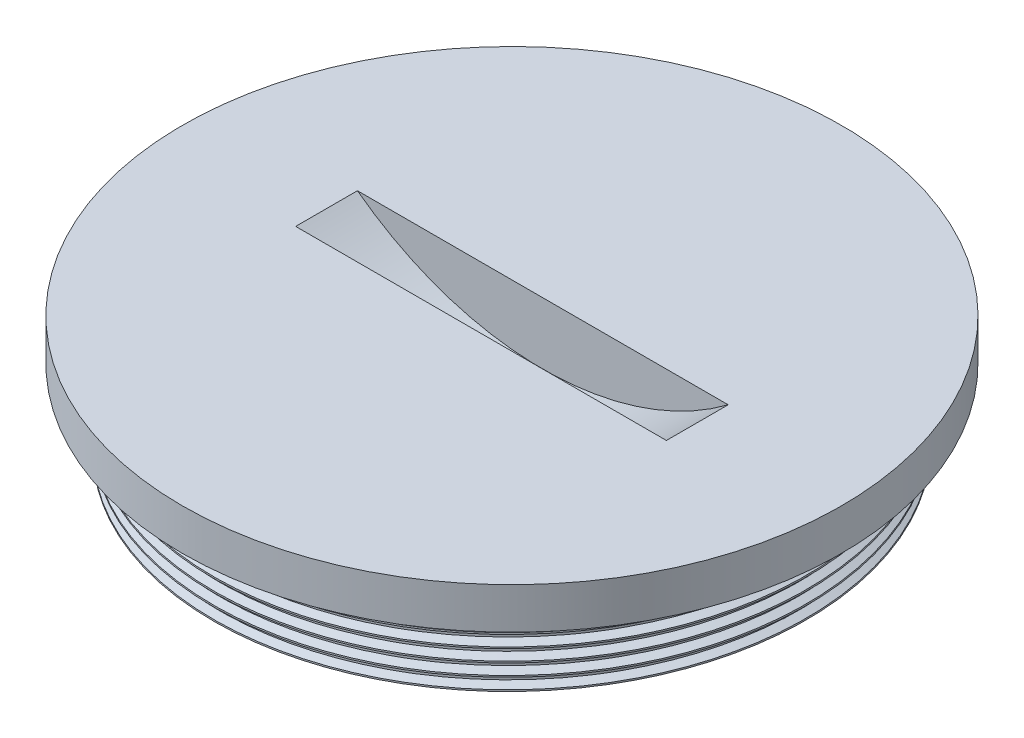
from build123d import *

# Parameters (mm, degrees)
SKETCH1_R                     = 14.05
BOSS_EXTRUDE1_DEPTH           = 12.7
MINCOLWIDTH_ONTRACKING1_PITCH = 0.6
CUT_EXTRUDE2_DEPTH            = 24.97001941
CUT_EXTRUDE2_DEPTH_BACK       = 24.97001941
SKETCH2_OUTSIDE_W             = 39.296
SKETCH2_OUTSIDE_H             = 23.696
SKETCH2_OUTSIDE_W_2           = 50
SKETCH2_OUTSIDE_H_2           = 3.81
SKETCH3_R                     = 16
BOSS_EXTRUDE2_DEPTH           = 2
CUT_EXTRUDE3_DEPTH            = 1.5
CUT_EXTRUDE3_DEPTH_BACK       = 1.5


with BuildPart() as part:
    # Sketch1 → Boss-Extrude1 (new body)
    with BuildSketch(Plane(origin=(0, 0, 0), x_dir=(1, 0, 0), z_dir=(0, 1, 0))):
        with Locations(Location((0, 0, 0), (0, 0, 270))):
            Circle(SKETCH1_R)
    extrude(amount=BOSS_EXTRUDE1_DEPTH)

    # MinColWidth_OnTracking1: the profile of HeaderRowsCount1 profile screwed along a right-hand helix of 21.166667 turns, 6 arcs to a turn; built about Z, then put on its axis
    mincolwidth_ontracking1_z = Axis((0, 0, 0), (0, 0, 1))
    mincolwidth_ontracking1_corners = [(14.0497, 0, -0.000173205), (14.374759525, 0, 0.187499999), (14.374759525, 0, 0.262499999), (14.0497, 0, 0.450173203)]
    with BuildLine(mode=Mode.PRIVATE) as mincolwidth_ontracking1_profile:
        Line(mincolwidth_ontracking1_corners[0], mincolwidth_ontracking1_corners[1])
        Line(mincolwidth_ontracking1_corners[1], mincolwidth_ontracking1_corners[2])
        Line(mincolwidth_ontracking1_corners[2], mincolwidth_ontracking1_corners[3])
        Line(mincolwidth_ontracking1_corners[3], mincolwidth_ontracking1_corners[0])
    mincolwidth_ontracking1_cap = Face(mincolwidth_ontracking1_profile.wire())
    mincolwidth_ontracking1_turn_angles = [0, 30, 60, 90, 120, 150, 180, 210, 240, 270, 300, 330, 360]
    mincolwidth_ontracking1_turn_weights = [1, 0.8660254037844387, 1, 0.8660254037844387, 1, 0.8660254037844387, 1, 0.8660254037844387, 1, 0.8660254037844387, 1, 0.8660254037844387, 1]
    mincolwidth_ontracking1_turn_rails = [Edge.make_bspline([Vector(p[0], p[1], 0).rotate(mincolwidth_ontracking1_z, mincolwidth_ontracking1_turn_angles[k]) / mincolwidth_ontracking1_turn_weights[k] + Vector(0, 0, p[2] + MINCOLWIDTH_ONTRACKING1_PITCH * mincolwidth_ontracking1_turn_angles[k] / 360) for k in range(13)], [0, 0, 0, 1, 1, 2, 2, 3, 3, 4, 4, 5, 5, 6, 6, 6], 2, mincolwidth_ontracking1_turn_weights) for p in mincolwidth_ontracking1_corners]
    mincolwidth_ontracking1_turn_sides = [Face.make_surface_from_curves(mincolwidth_ontracking1_turn_rails[p[0]], mincolwidth_ontracking1_turn_rails[p[1]]) for p in [(0, 1), (1, 2), (2, 3), (3, 0)]]
    mincolwidth_ontracking1_last_angles = [7560, 7590, 7620]
    mincolwidth_ontracking1_last_weights = [1, 0.8660254037844387, 1]
    mincolwidth_ontracking1_last_rails = [Edge.make_bspline([Vector(p[0], p[1], 0).rotate(mincolwidth_ontracking1_z, mincolwidth_ontracking1_last_angles[k]) / mincolwidth_ontracking1_last_weights[k] + Vector(0, 0, p[2] + MINCOLWIDTH_ONTRACKING1_PITCH * mincolwidth_ontracking1_last_angles[k] / 360) for k in range(3)], [0, 0, 0, 1, 1, 1], 2, mincolwidth_ontracking1_last_weights) for p in mincolwidth_ontracking1_corners]
    mincolwidth_ontracking1_last_sides = [Face.make_surface_from_curves(mincolwidth_ontracking1_last_rails[p[0]], mincolwidth_ontracking1_last_rails[p[1]]) for p in [(0, 1), (1, 2), (2, 3), (3, 0)]]
    mincolwidth_ontracking1 = Plane(origin=(0, 12.7, 0), x_dir=(-1, 0, 0), z_dir=(0, -1, 0)) * Solid(Shell([*[p.moved(Location((0, 0, MINCOLWIDTH_ONTRACKING1_PITCH * i))) for i in range(21) for p in mincolwidth_ontracking1_turn_sides], *mincolwidth_ontracking1_last_sides, mincolwidth_ontracking1_cap, mincolwidth_ontracking1_cap.rotate(mincolwidth_ontracking1_z, 7620).moved(Location((0, 0, MINCOLWIDTH_ONTRACKING1_PITCH * 7620 / 360)))]))
    add(mincolwidth_ontracking1)

    # Sketch2 outside → Cut-Extrude2 (cut, two sides: drawn at the far end of the back side and taken through both)
    with BuildSketch(Plane.XY.offset(-CUT_EXTRUDE2_DEPTH_BACK)):
        with Locations((0, 6.125)):
            Rectangle(SKETCH2_OUTSIDE_W, SKETCH2_OUTSIDE_H)
        with Locations((0, 6)):
            Rectangle(SKETCH2_OUTSIDE_W_2, SKETCH2_OUTSIDE_H_2, mode=Mode.SUBTRACT)
    extrude(amount=CUT_EXTRUDE2_DEPTH + CUT_EXTRUDE2_DEPTH_BACK, mode=Mode.SUBTRACT)

    # Sketch3 → Boss-Extrude2 (add)
    with BuildSketch(Plane(origin=(0, 7.905, 0), x_dir=(1, 0, 0), z_dir=(0, 1, 0))):
        with Locations(Location((0, 0, 0), (0, 0, 270))):
            Circle(SKETCH3_R)
    extrude(amount=BOSS_EXTRUDE2_DEPTH)

    # Sketch4 → Cut-Extrude3 (cut, two sides: drawn at the far end of the back side and taken through both)
    with BuildSketch(Plane.XY.offset(-CUT_EXTRUDE3_DEPTH_BACK)):
        with BuildLine():
            Line((-9, 9.905), (9, 9.905))
            ThreePointArc((9, 9.905), (0, 6.905), (-9, 9.905))
        make_face()
    extrude(amount=CUT_EXTRUDE3_DEPTH + CUT_EXTRUDE3_DEPTH_BACK, mode=Mode.SUBTRACT)


solid = part.part
